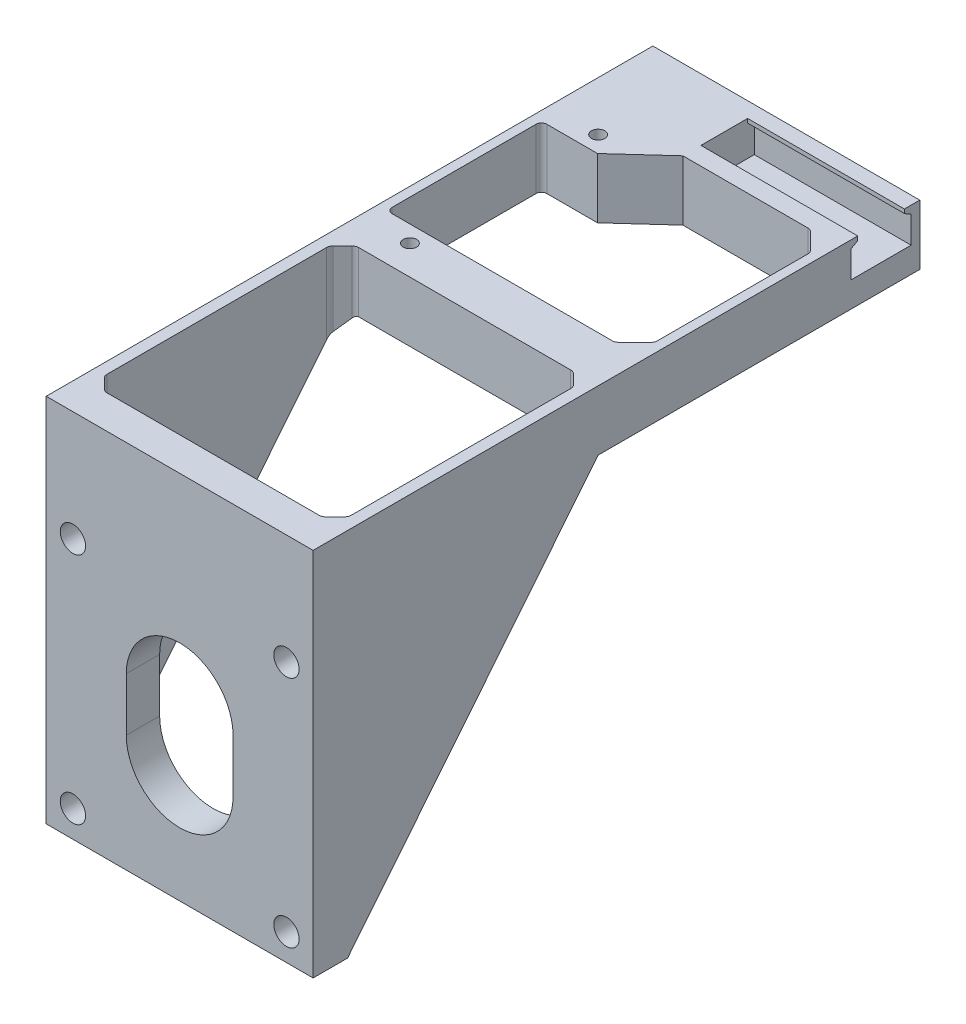
from build123d import *

# Parameters (mm, degrees)
BOSS_EXTRUDE1_START      = -1
SKETCH1_W                = 1.4
SKETCH1_H                = 89.2
BOSS_EXTRUDE1_DEPTH      = 9
SKETCH4_W                = 40
SKETCH4_H                = 12
BOSS_EXTRUDE3_DEPTH      = 9
SERVO_HOLDER_DEPTH       = 1
SERVO_HOLDER_DEPTH_BACK  = 9
SKETCH3_W                = 14
SKETCH3_H                = 7
SKETCH3_R                = 1
SKETCH37_W               = 26
SKETCH37_H               = 7
BOSS_EXTRUDE19_DEPTH     = 10
CUT_EXTRUDE10_DEPTH      = 93.388310949
CUT_EXTRUDE10_DEPTH_BACK = 93.388310949
SKETCH29_W               = 48.801454262
SKETCH29_H               = 6.177389624
BOSS_EXTRUDE17_DEPTH     = 3
SKETCH39_W               = 1.4
SKETCH39_H               = 41.3
BOSS_EXTRUDE20_DEPTH     = 9
CUT_EXTRUDE13_DEPTH      = 23.5
CHAMFER2_SIZE            = 0.6
CHAMFER2_SIZE_2          = 1.039230485
CHAMFER3_SIZE            = 3
CHAMFER4_SIZE            = 2.5
CUT_EXTRUDE16_DEPTH      = 10
FILLET11_R               = 0.8
SKETCH51_W               = 40
SKETCH51_H               = 41
CUT_EXTRUDE17_DEPTH      = 10
SKETCH50_W               = 40
SKETCH50_H               = 55.5
SKETCH50_R               = 1.9
BOSS_EXTRUDE24_DEPTH     = 5
SKETCH53_W               = 1.7
SKETCH53_H               = 37.711538462
BOSS_EXTRUDE25_DEPTH     = 9
CHAMFER6_SIZE            = 37.709072194
CHAMFER6_SIZE_2          = 46.7
CHAMFER5_SIZE            = 2
FILLET13_R               = 1


with BuildPart() as part:
    # Sketch1 → Boss-Extrude1 (new body)
    with BuildSketch(Plane(origin=(0, 0, 0), x_dir=(1, 0, 0), z_dir=(0, 1, 0)).offset(BOSS_EXTRUDE1_START)):
        with Locations((-20.7, 25.311538462)):
            Rectangle(SKETCH1_W, SKETCH1_H)
    extrude(amount=-BOSS_EXTRUDE1_DEPTH)

    # Sketch4 → Boss-Extrude3 (add)
    with BuildSketch(Plane.XZ.offset(10)):
        with Locations((-1.4, -63.911538462)):
            Rectangle(SKETCH4_W, SKETCH4_H)
    extrude(amount=-BOSS_EXTRUDE3_DEPTH)

    # Sketch3 → Servo Holder (add, two sides: drawn at the far end of the back side and taken through both)
    # profile 1 of 2: a face of its own
    with BuildSketch(Plane.XZ.offset(10).offset(-SERVO_HOLDER_DEPTH_BACK)):
        with Locations((-14.4, -55.311538462)):
            Rectangle(SKETCH3_W, SKETCH3_H)
        with Locations(Location((-14, -54.311538462, 0), (0, 0, 270))):
            Circle(SKETCH3_R, mode=Mode.SUBTRACT)
    # profile 2 of 2: a face of its own
    with BuildSketch(Plane.XZ.offset(10).offset(-SERVO_HOLDER_DEPTH_BACK)):
        with Locations((-14.4, -25.111538462)):
            Rectangle(SKETCH3_W, SKETCH3_H)
        with Locations(Location((-14, -26.111538462, 0), (0, 0, 90))):
            Circle(SKETCH3_R, mode=Mode.SUBTRACT)
    extrude(amount=SERVO_HOLDER_DEPTH + SERVO_HOLDER_DEPTH_BACK)

    # Sketch37 → Boss-Extrude19 (add)
    with BuildSketch(Plane(origin=(0, -1, 0), x_dir=(1, 0, 0), z_dir=(0, 1, 0))):
        with Locations((5.6, 25.111538462)):
            Rectangle(SKETCH37_W, SKETCH37_H)
    extrude(amount=-BOSS_EXTRUDE19_DEPTH)

    # Sketch29 → Cut-Extrude10 (cut, two sides: drawn at the far end of the back side and taken through both)
    with BuildSketch(Plane(origin=(0, 0, -69.911538462), x_dir=(-1, 0, 0), z_dir=(0, 0, -1)).offset(-CUT_EXTRUDE10_DEPTH_BACK)):
        with Locations((-3.000727131, -13.088694812)):
            Rectangle(SKETCH29_W, SKETCH29_H)
    extrude(amount=CUT_EXTRUDE10_DEPTH + CUT_EXTRUDE10_DEPTH_BACK, mode=Mode.SUBTRACT)

    # Sketch35 → Boss-Extrude17 (add)
    with BuildSketch(Plane(origin=(18.6, 0, 0), x_dir=(0, 0, -1), z_dir=(1, 0, 0))):
        Polygon((-2, -1), (21.611538462, -1), (21.611538462, -10), (-19.288461538, -10), (-19.288461538, -1), align=None)
    extrude(amount=-BOSS_EXTRUDE17_DEPTH)

    # Sketch39 → Boss-Extrude20 (add)
    with BuildSketch(Plane(origin=(0, -1, 0), x_dir=(1, 0, 0), z_dir=(0, 1, 0))):
        with Locations((17.9, 49.261538462)):
            Rectangle(SKETCH39_W, SKETCH39_H)
    extrude(amount=-BOSS_EXTRUDE20_DEPTH)

    # Sketch40 → Cut-Extrude13 (cut)
    with BuildSketch(Plane(origin=(18.6, 0, 0), x_dir=(0, 0, -1), z_dir=(1, 0, 0))):
        Polygon((64.111538462, -1), (60.611538462, -1), (60.611538462, -2.2), (59.611538462, -2.2), (59.611538462, -6.2), (64.111538462, -6.2), align=None)
        Polygon((67.611538462, -1), (64.111538462, -1), (64.111538462, -6.2), (68.611538462, -6.2), (68.611538462, -2.2), (67.611538462, -2.2), align=None)
    extrude(amount=-CUT_EXTRUDE13_DEPTH, mode=Mode.SUBTRACT)

    # Chamfer2
    # the kernel refuses this chamfer: 1.039230485, 0.6 mm, written as the material it takes off along each edge
    with BuildSketch(Plane(origin=(21.288578382, -2.2, -60.611538462), x_dir=(0, 0.9983227437537925, -0.05789386240267317), z_dir=(-1, 0, 0))) as chamfer2_piece_1_section:
        Polygon((CHAMFER2_SIZE * 0.998322743754, -CHAMFER2_SIZE * 0.0578938624027), (-CHAMFER2_SIZE_2 * 0.0578938623771, -CHAMFER2_SIZE_2 * 0.998322743313), (0, 0), align=None)
    chamfer2_piece_1 = extrude(amount=26.188578382, mode=Mode.PRIVATE)
    chamfer2_piece_1 = split(chamfer2_piece_1, bisect_by=Plane(origin=(8.194289191, -2.005782009, -59.611538462), z_dir=(0, 0, -1)), keep=Keep.TOP, mode=Mode.PRIVATE)
    add(chamfer2_piece_1, mode=Mode.SUBTRACT)
    with BuildSketch(Plane(origin=(21.288578382, -2.2, -67.611538462), x_dir=(0, 0.9983227437537925, 0.05789386240267317), z_dir=(-1, 0, 0))) as chamfer2_piece_2_section:
        Polygon((CHAMFER2_SIZE * 0.998322743754, CHAMFER2_SIZE * 0.0578938624027), (-CHAMFER2_SIZE_2 * 0.0578938623771, CHAMFER2_SIZE_2 * 0.998322743313), (0, 0), align=None)
    chamfer2_piece_2 = extrude(amount=26.188578382, mode=Mode.PRIVATE)
    chamfer2_piece_2 = split(chamfer2_piece_2, bisect_by=Plane(origin=(8.194289191, -2.005782009, -68.611538462), z_dir=(0, 0, 1)), keep=Keep.TOP, mode=Mode.PRIVATE)
    add(chamfer2_piece_2, mode=Mode.SUBTRACT)

    # Chamfer3
    chamfer3_edges = [part.edges().sort_by_distance(p)[0] for p in [
        (17.2, -5.5, -57.911538462),
        (17.2, -5.5, -28.611538462),
    ]]
    chamfer(chamfer3_edges, length=CHAMFER3_SIZE)

    # Chamfer4
    chamfer4_edges = [part.edges().sort_by_distance(p)[0] for p in [
        (-7.4, -5.5, -57.911538462),
    ]]
    chamfer(chamfer4_edges, length=CHAMFER4_SIZE)

    # Sketch43 → Cut-Extrude16 (cut)
    with BuildSketch(Plane(origin=(0, -1, 0), x_dir=(1, 0, 0), z_dir=(0, 1, 0))):
        Polygon((-4.9, 57.911538462), (-11.6, 51.811538462), (-4.9, 51.811538462), align=None)
    extrude(amount=-CUT_EXTRUDE16_DEPTH, mode=Mode.SUBTRACT)

    # Fillet11
    fillet11_edges = [part.edges().sort_by_distance(p)[0] for p in [
        (17.2, -5.5, -54.911538462),
        (17.2, -5.5, -31.611538462),
        (14.2, -5.5, -28.611538462),
        (14.2, -5.5, -57.911538462),
        (-20, -5.5, -51.811538462),
        (-20, -5.5, -28.611538462),
    ]]
    fillet(fillet11_edges, radius=FILLET11_R)

    # Sketch51 → Cut-Extrude17 (cut)
    with BuildSketch(Plane(origin=(0, -1, 0), x_dir=(1, 0, 0), z_dir=(0, 1, 0))):
        with Locations((-1.4, 1.211538462)):
            Rectangle(SKETCH51_W, SKETCH51_H)
    extrude(amount=-CUT_EXTRUDE17_DEPTH, mode=Mode.SUBTRACT)



with BuildPart() as body_2:
    # Sketch50 → Boss-Extrude24 (new body)
    with BuildSketch(Plane.XY.offset(16)):
        with Locations((-1.4, -28.75)):
            Rectangle(SKETCH50_W, SKETCH50_H)
        with Locations((-17.4, -17.5)):
            Circle(SKETCH50_R, mode=Mode.SUBTRACT)
        with Locations(Location((14.6, -17.5, 0), (0, 0, 180))):
            Circle(SKETCH50_R, mode=Mode.SUBTRACT)
        with Locations((14.6, -52.5)):
            Circle(SKETCH50_R, mode=Mode.SUBTRACT)
        with Locations(Location((-17.4, -52.5, 0), (0, 0, 180))):
            Circle(SKETCH50_R, mode=Mode.SUBTRACT)
        with BuildLine():
            Line((6.6, -31), (6.6, -39))
            ThreePointArc((6.6, -39), (-1.4, -47), (-9.4, -39))
            Line((-9.4, -39), (-9.4, -31))
            ThreePointArc((-9.4, -31), (-1.4, -23), (6.6, -31))
        make_face(mode=Mode.SUBTRACT)
    extrude(amount=BOSS_EXTRUDE24_DEPTH)


with BuildPart() as part_1:
    add(part.part)

    add(body_2.part)  # Boss-Extrude25 merges body 2
    # Sketch53 → Boss-Extrude25 (add)
    with BuildSketch(Plane(origin=(0, -1, 0), x_dir=(1, 0, 0), z_dir=(0, 1, 0))):
        with Locations((17.75, 2.855769231)):
            Rectangle(SKETCH53_W, SKETCH53_H)
        with Locations((-20.55, 2.855769231)):
            Rectangle(SKETCH53_W, SKETCH53_H)
    extrude(amount=-BOSS_EXTRUDE25_DEPTH)

    # Chamfer6
    # the kernel refuses this chamfer: 46.7, 37.709072194 mm, written as the material it adds along each edge
    with BuildSketch(Plane(origin=(-103.519116723, -10, 16), x_dir=(0, 0.03735176981942527, -0.999302179168722), z_dir=(1, 0, 0))) as chamfer6_piece_1_section:
        Polygon((CHAMFER6_SIZE * 0.99930217918, -CHAMFER6_SIZE * 0.0373517698198), (-CHAMFER6_SIZE_2 * 0.0373517698194, -CHAMFER6_SIZE_2 * 0.999302179169), (0, 0), align=None)
    chamfer6_piece_1 = extrude(amount=242.538233446, mode=Mode.PRIVATE)
    chamfer6_piece_1 = split(chamfer6_piece_1, bisect_by=Plane(origin=(-20.55, -56.5, 3.430079709), z_dir=(0, 1, 0)), keep=Keep.TOP, mode=Mode.PRIVATE)
    chamfer6_piece_1 = split(chamfer6_piece_1, bisect_by=Plane(origin=(-19.7, -25.566098081, 3.430079709), z_dir=(-1, 0, 0)), keep=Keep.TOP, mode=Mode.PRIVATE)
    chamfer6_piece_1 = split(chamfer6_piece_1, bisect_by=Plane(origin=(-21.4, -25.566098081, 3.430079709), z_dir=(1, 0, 0)), keep=Keep.TOP, mode=Mode.PRIVATE)
    add(chamfer6_piece_1)
    with BuildSketch(Plane(origin=(16.9, -10, 16), x_dir=(0, 0.03735176981942527, -0.999302179168722), z_dir=(1, 0, 0))) as chamfer6_piece_2_section:
        Polygon((CHAMFER6_SIZE * 0.99930217918, -CHAMFER6_SIZE * 0.0373517698198), (-CHAMFER6_SIZE_2 * 0.0373517698194, -CHAMFER6_SIZE_2 * 0.999302179169), (0, 0), align=None)
    chamfer6_piece_2 = extrude(amount=1.7, mode=Mode.PRIVATE)
    chamfer6_piece_2 = split(chamfer6_piece_2, bisect_by=Plane(origin=(17.75, -56.5, 3.430079709), z_dir=(0, 1, 0)), keep=Keep.TOP, mode=Mode.PRIVATE)
    add(chamfer6_piece_2)
    with BuildSketch(Plane(origin=(100.719116723, -10, 16), x_dir=(0, 0.03735176981942527, -0.999302179168722), z_dir=(-1, 0, 0))) as chamfer6_piece_3_section:
        Polygon((CHAMFER6_SIZE * 0.99930217918, CHAMFER6_SIZE * 0.0373517698198), (-CHAMFER6_SIZE_2 * 0.0373517698194, CHAMFER6_SIZE_2 * 0.999302179169), (0, 0), align=None)
    chamfer6_piece_3 = extrude(amount=242.538233446, mode=Mode.PRIVATE)
    chamfer6_piece_3 = split(chamfer6_piece_3, bisect_by=Plane(origin=(17.75, -56.5, 3.430079709), z_dir=(0, 1, 0)), keep=Keep.TOP, mode=Mode.PRIVATE)
    chamfer6_piece_3 = split(chamfer6_piece_3, bisect_by=Plane(origin=(18.6, -25.566098081, 3.430079709), z_dir=(-1, 0, 0)), keep=Keep.TOP, mode=Mode.PRIVATE)
    chamfer6_piece_3 = split(chamfer6_piece_3, bisect_by=Plane(origin=(16.9, -25.566098081, 3.430079709), z_dir=(1, 0, 0)), keep=Keep.TOP, mode=Mode.PRIVATE)
    add(chamfer6_piece_3)
    with BuildSketch(Plane(origin=(-19.7, -10, 16), x_dir=(0, 0.03735176981942527, -0.999302179168722), z_dir=(-1, 0, 0))) as chamfer6_piece_4_section:
        Polygon((CHAMFER6_SIZE * 0.99930217918, CHAMFER6_SIZE * 0.0373517698198), (-CHAMFER6_SIZE_2 * 0.0373517698194, CHAMFER6_SIZE_2 * 0.999302179169), (0, 0), align=None)
    chamfer6_piece_4 = extrude(amount=1.7, mode=Mode.PRIVATE)
    chamfer6_piece_4 = split(chamfer6_piece_4, bisect_by=Plane(origin=(-20.55, -56.5, 3.430079709), z_dir=(0, 1, 0)), keep=Keep.TOP, mode=Mode.PRIVATE)
    add(chamfer6_piece_4)

    # Chamfer5
    # the kernel refuses this chamfer: 2 mm, written as the material it adds along each edge
    with BuildSketch(Plane(origin=(16.9, -56.5, 16), x_dir=(-0.9996219169115486, 9.398995055906874e-15, 0.027495876601428135), z_dir=(0, 1, 0))) as chamfer5_piece_1_section:
        Polygon((CHAMFER5_SIZE * 0.999621916911, -CHAMFER5_SIZE * 0.0274958766107), (-CHAMFER5_SIZE * 0.0274958766014, -CHAMFER5_SIZE * 0.999621916912), (0, 0), align=None)
    chamfer5_piece_1 = extrude(amount=55.5, mode=Mode.PRIVATE)
    chamfer5_piece_1 = chamfer5_piece_1 - Plane(origin=(14.6, -52.5, 15.332756943), x_dir=(1, 0, 0), z_dir=(0, 0, -1)) * Cylinder(1.9, 119, mode=Mode.PRIVATE)
    chamfer5_piece_1 = chamfer5_piece_1 - Plane(origin=(14.6, -17.5, 15.332756943), x_dir=(-1, 0, 0), z_dir=(0, 0, -1)) * Cylinder(1.9, 119, mode=Mode.PRIVATE)
    chamfer5_piece_1 = split(chamfer5_piece_1, bisect_by=Plane(origin=(16.262747453, -39.032256487, 1.733742705), z_dir=(0, 0.6282346774929722, 0.7780239006581362)), keep=Keep.TOP, mode=Mode.PRIVATE)
    add(chamfer5_piece_1)
    with BuildSketch(Plane(origin=(-19.7, -1, 16), x_dir=(0.9996219169112968, 9.144800521055879e-15, 0.027495876610585647), z_dir=(0, -1, 0))) as chamfer5_piece_2_section:
        Polygon((CHAMFER5_SIZE * 0.999621916911, -CHAMFER5_SIZE * 0.0274958766106), (-CHAMFER5_SIZE * 0.0274958766106, -CHAMFER5_SIZE * 0.999621916911), (0, 0), align=None)
    chamfer5_piece_2 = extrude(amount=55.5, mode=Mode.PRIVATE)
    chamfer5_piece_2 = split(chamfer5_piece_2, bisect_by=Plane(origin=(-19.062747543, -39.032254695, 1.733741258), z_dir=(0, 0.6282346774929722, 0.7780239006581362)), keep=Keep.TOP, mode=Mode.PRIVATE)
    chamfer5_piece_2 = chamfer5_piece_2 - Plane(origin=(-17.4, -52.5, 15.332756844), x_dir=(-1, 0, 0), z_dir=(0, 0, -1)) * Cylinder(1.9, 119, mode=Mode.PRIVATE)
    chamfer5_piece_2 = chamfer5_piece_2 - Plane(origin=(-17.4, -17.5, 15.332756844), x_dir=(1, 0, 0), z_dir=(0, 0, -1)) * Cylinder(1.9, 119, mode=Mode.PRIVATE)
    add(chamfer5_piece_2)
    with BuildSketch(Plane(origin=(16.9, -1, -21.711538462), x_dir=(-0.9996219169112968, 0, -0.027495876610585623), z_dir=(0, -1, 0))) as chamfer5_piece_3_section:
        Polygon((CHAMFER5_SIZE * 0.999621916911, -CHAMFER5_SIZE * 0.0274958766106), (-CHAMFER5_SIZE * 0.0274958766106, -CHAMFER5_SIZE * 0.999621916911), (0, 0), align=None)
    chamfer5_piece_3 = extrude(amount=9, mode=Mode.PRIVATE)
    chamfer5_piece_3 = split(chamfer5_piece_3, bisect_by=Plane(origin=(16.240555147, -7.596785669, -23.649607156), z_dir=(0, 0.6282346774929722, 0.7780239006581362)), keep=Keep.TOP, mode=Mode.PRIVATE)
    add(chamfer5_piece_3)
    with BuildSketch(Plane(origin=(16.9, -1, -21.711538462), x_dir=(-0.9996219169112968, 0, -0.027495876610585623), z_dir=(0, -1, 0))) as chamfer5_piece_4_section:
        Polygon((CHAMFER5_SIZE * 0.999621916911, -CHAMFER5_SIZE * 0.0274958766106), (-CHAMFER5_SIZE * 0.0274958766106, -CHAMFER5_SIZE * 0.999621916911), (0, 0), align=None)
    chamfer5_piece_4 = extrude(amount=14.143365976, mode=Mode.PRIVATE)
    chamfer5_piece_4 = split(chamfer5_piece_4, bisect_by=Plane(origin=(16.445051709, -10, -20.667722812), z_dir=(0, -1, 0)), keep=Keep.TOP, mode=Mode.PRIVATE)
    chamfer5_piece_4 = split(chamfer5_piece_4, bisect_by=Plane(origin=(16.445051709, -10.899314724, -20.982898236), z_dir=(0, 0.6282346774929722, 0.7780239006581362)), keep=Keep.TOP, mode=Mode.PRIVATE)
    add(chamfer5_piece_4)
    with BuildSketch(Plane(origin=(16.9, -1, -21.711538462), x_dir=(-0.9996219169112968, 0, -0.027495876610585623), z_dir=(0, -1, 0))) as chamfer5_piece_5_section:
        Polygon((CHAMFER5_SIZE * 0.999621916911, -CHAMFER5_SIZE * 0.0274958766106), (-CHAMFER5_SIZE * 0.0274958766106, -CHAMFER5_SIZE * 0.999621916911), (0, 0), align=None)
    chamfer5_piece_5 = extrude(amount=9, mode=Mode.PRIVATE)
    chamfer5_piece_5 = split(chamfer5_piece_5, bisect_by=Plane(origin=(15.504496117, -9.96219574, -21.739598181), z_dir=(0, -0.6282346774929722, -0.7780239006581362)), keep=Keep.TOP, mode=Mode.PRIVATE)
    add(chamfer5_piece_5)
    with BuildSketch(Plane(origin=(-19.7, -1, -21.711538462), x_dir=(0.9996219169112968, 0, -0.0274958766105856), z_dir=(0, -1, 0))) as chamfer5_piece_6_section:
        Polygon((CHAMFER5_SIZE * 0.999621916911, CHAMFER5_SIZE * 0.0274958766106), (-CHAMFER5_SIZE * 0.0274958766106, CHAMFER5_SIZE * 0.999621916911), (0, 0), align=None)
    chamfer5_piece_6 = extrude(amount=9, mode=Mode.PRIVATE)
    chamfer5_piece_6 = split(chamfer5_piece_6, bisect_by=Plane(origin=(-19.040555147, -7.596785669, -23.649607156), z_dir=(0, 0.6282346774929722, 0.7780239006581362)), keep=Keep.TOP, mode=Mode.PRIVATE)
    add(chamfer5_piece_6)
    with BuildSketch(Plane(origin=(-19.7, -1, -21.711538462), x_dir=(0.9996219169112968, 0, -0.0274958766105856), z_dir=(0, -1, 0))) as chamfer5_piece_7_section:
        Polygon((CHAMFER5_SIZE * 0.999621916911, CHAMFER5_SIZE * 0.0274958766106), (-CHAMFER5_SIZE * 0.0274958766106, CHAMFER5_SIZE * 0.999621916911), (0, 0), align=None)
    chamfer5_piece_7 = extrude(amount=14.143365976, mode=Mode.PRIVATE)
    chamfer5_piece_7 = split(chamfer5_piece_7, bisect_by=Plane(origin=(-19.245051709, -10.899314724, -20.982898236), z_dir=(0, 0.6282346774929722, 0.7780239006581362)), keep=Keep.TOP, mode=Mode.PRIVATE)
    chamfer5_piece_7 = split(chamfer5_piece_7, bisect_by=Plane(origin=(-19.245051709, -10, -20.667722812), z_dir=(0, -1, 0)), keep=Keep.TOP, mode=Mode.PRIVATE)
    add(chamfer5_piece_7)
    with BuildSketch(Plane(origin=(-19.7, -1, -21.711538462), x_dir=(0.9996219169112968, 0, -0.0274958766105856), z_dir=(0, -1, 0))) as chamfer5_piece_8_section:
        Polygon((CHAMFER5_SIZE * 0.999621916911, CHAMFER5_SIZE * 0.0274958766106), (-CHAMFER5_SIZE * 0.0274958766106, CHAMFER5_SIZE * 0.999621916911), (0, 0), align=None)
    chamfer5_piece_8 = extrude(amount=9, mode=Mode.PRIVATE)
    chamfer5_piece_8 = split(chamfer5_piece_8, bisect_by=Plane(origin=(-18.304496117, -9.96219574, -21.739598181), z_dir=(0, -0.6282346774929722, -0.7780239006581362)), keep=Keep.TOP, mode=Mode.PRIVATE)
    add(chamfer5_piece_8)

    # Fillet13
    # the kernel refuses this fillet: 1 mm, written as the material it adds along each edge
    with BuildSketch(Plane(origin=(16.9, -55.25867636, 14), x_dir=(0, 0, -1), z_dir=(0, 1, 0))) as fillet13_piece_1_section:
        with BuildLine():
            CenterArc((FILLET13_R * 0.414213562376, FILLET13_R), FILLET13_R, 225, 45)
            Line((-FILLET13_R * 0.292893218814, FILLET13_R * 0.292893218817), (0, 0))
            Line((0, 0), (FILLET13_R * 0.414213562376, 0))
        make_face()
    fillet13_piece_1 = extrude(amount=54.25867636, mode=Mode.PRIVATE)
    fillet13_piece_1 = split(fillet13_piece_1, bisect_by=Plane(origin=(16.837951776, -38.093007008, 0.97532244), z_dir=(0, 0.6282346774930556, 0.7780239006580688)), keep=Keep.TOP, mode=Mode.PRIVATE)
    add(fillet13_piece_1)
    with BuildSketch(Plane(origin=(14.9, -16.659367602, 16), x_dir=(0.7071067811898626, 0, -0.7071067811832326), z_dir=(0, 1, 0))) as fillet13_piece_2_section:
        with BuildLine():
            CenterArc((FILLET13_R * 0.41421356237, FILLET13_R), FILLET13_R, 225, 45)
            Line((-FILLET13_R * 0.292893218813, FILLET13_R * 0.29289321881), (0, 0))
            Line((0, 0), (FILLET13_R * 0.41421356237, 0))
        make_face()
    fillet13_piece_2 = extrude(amount=15.659367602, mode=Mode.PRIVATE)
    fillet13_piece_2 = fillet13_piece_2 - Plane(origin=(14.6, -17.5, 15.93807593), x_dir=(-1, 0, 0), z_dir=(0, 0, -1)) * Cylinder(1.9, 33, mode=Mode.PRIVATE)
    add(fillet13_piece_2)
    with BuildSketch(Plane(origin=(14.9, -56.5, 16), x_dir=(0.7071067811898647, 0, -0.7071067811832304), z_dir=(0, 1, 0))) as fillet13_piece_3_section:
        with BuildLine():
            CenterArc((FILLET13_R * 0.41421356237, FILLET13_R), FILLET13_R, 225, 45)
            Line((-FILLET13_R * 0.292893218813, FILLET13_R * 0.29289321881), (0, 0))
            Line((0, 0), (FILLET13_R * 0.41421356237, 0))
        make_face()
    fillet13_piece_3 = extrude(amount=3.159367602, mode=Mode.PRIVATE)
    fillet13_piece_3 = split(fillet13_piece_3, bisect_by=Plane(origin=(14.874971932, -55.902415279, 15.355970453), z_dir=(0, 0.6282346774930556, 0.7780239006580688)), keep=Keep.TOP, mode=Mode.PRIVATE)
    fillet13_piece_3 = fillet13_piece_3 - Plane(origin=(14.6, -52.5, 15.938106757), x_dir=(1, 0, 0), z_dir=(0, 0, -1)) * Cylinder(1.9, 8, mode=Mode.PRIVATE)
    add(fillet13_piece_3)
    with BuildSketch(Plane(origin=(-17.7, -53.340632398, 16), x_dir=(-0.7071067811862645, 0, -0.7071067811868306), z_dir=(0, -1, 0))) as fillet13_piece_4_section:
        with BuildLine():
            CenterArc((FILLET13_R * 0.414213562373, FILLET13_R), FILLET13_R, 225, 45)
            Line((-FILLET13_R * 0.292893218814, FILLET13_R * 0.292893218814), (0, 0))
            Line((0, 0), (FILLET13_R * 0.414213562373, 0))
        make_face()
    fillet13_piece_4 = extrude(amount=3.159367602, mode=Mode.PRIVATE)
    fillet13_piece_4 = fillet13_piece_4 - Plane(origin=(-17.4, -52.5, 15.938106777), x_dir=(-1, 0, 0), z_dir=(0, 0, -1)) * Cylinder(1.9, 8, mode=Mode.PRIVATE)
    fillet13_piece_4 = split(fillet13_piece_4, bisect_by=Plane(origin=(-17.674971948, -55.902415691, 15.355970786), z_dir=(0, 0.6282346774930556, 0.7780239006580688)), keep=Keep.TOP, mode=Mode.PRIVATE)
    add(fillet13_piece_4)
    with BuildSketch(Plane(origin=(-17.7, -1, 16), x_dir=(-0.7071067811862667, 0, -0.7071067811868285), z_dir=(0, -1, 0))) as fillet13_piece_5_section:
        with BuildLine():
            CenterArc((FILLET13_R * 0.414213562373, FILLET13_R), FILLET13_R, 225, 45)
            Line((-FILLET13_R * 0.292893218814, FILLET13_R * 0.292893218814), (0, 0))
            Line((0, 0), (FILLET13_R * 0.414213562373, 0))
        make_face()
    fillet13_piece_5 = extrude(amount=15.659367602, mode=Mode.PRIVATE)
    fillet13_piece_5 = fillet13_piece_5 - Plane(origin=(-17.4, -17.5, 15.938075915), x_dir=(1, 0, 0), z_dir=(0, 0, -1)) * Cylinder(1.9, 33, mode=Mode.PRIVATE)
    add(fillet13_piece_5)
    with BuildSketch(Plane(origin=(-19.7, -1, 14), x_dir=(0.7071067811862645, 0, 0.7071067811868306), z_dir=(0, -1, 0))) as fillet13_piece_6_section:
        with BuildLine():
            CenterArc((FILLET13_R * 0.414213562373, -FILLET13_R), FILLET13_R, 90, 45)
            Line((-FILLET13_R * 0.292893218813, -FILLET13_R * 0.292893218813), (0, 0))
            Line((0, 0), (FILLET13_R * 0.414213562373, 0))
        make_face()
    fillet13_piece_6 = extrude(amount=54.25867636, mode=Mode.PRIVATE)
    fillet13_piece_6 = split(fillet13_piece_6, bisect_by=Plane(origin=(-19.637951776, -38.093007007, 0.975322439), z_dir=(0, 0.6282346774930556, 0.7780239006580688)), keep=Keep.TOP, mode=Mode.PRIVATE)
    add(fillet13_piece_6)
    with BuildSketch(Plane(origin=(-17.7, -18.340632398, 16), x_dir=(-0.7071067811862645, 0, -0.7071067811868306), z_dir=(0, -1, 0))) as fillet13_piece_7_section:
        with BuildLine():
            CenterArc((FILLET13_R * 0.414213562373, FILLET13_R), FILLET13_R, 225, 45)
            Line((-FILLET13_R * 0.292893218814, FILLET13_R * 0.292893218814), (0, 0))
            Line((0, 0), (FILLET13_R * 0.414213562373, 0))
        make_face()
    fillet13_piece_7 = extrude(amount=33.318735204, mode=Mode.PRIVATE)
    fillet13_piece_7 = fillet13_piece_7 - Plane(origin=(-17.4, -52.5, 15.938083204), x_dir=(-1, 0, 0), z_dir=(0, 0, -1)) * Cylinder(1.9, 69, mode=Mode.PRIVATE)
    fillet13_piece_7 = fillet13_piece_7 - Plane(origin=(-17.4, -17.5, 15.938083204), x_dir=(1, 0, 0), z_dir=(0, 0, -1)) * Cylinder(1.9, 69, mode=Mode.PRIVATE)
    add(fillet13_piece_7)
    with BuildSketch(Plane(origin=(14.9, -51.659367602, 16), x_dir=(0.7071067811898626, 0, -0.7071067811832326), z_dir=(0, 1, 0))) as fillet13_piece_8_section:
        with BuildLine():
            CenterArc((FILLET13_R * 0.41421356237, FILLET13_R), FILLET13_R, 225, 45)
            Line((-FILLET13_R * 0.292893218813, FILLET13_R * 0.29289321881), (0, 0))
            Line((0, 0), (FILLET13_R * 0.41421356237, 0))
        make_face()
    fillet13_piece_8 = extrude(amount=33.318735204, mode=Mode.PRIVATE)
    fillet13_piece_8 = fillet13_piece_8 - Plane(origin=(14.6, -17.5, 15.938083204), x_dir=(-1, 0, 0), z_dir=(0, 0, -1)) * Cylinder(1.9, 69, mode=Mode.PRIVATE)
    fillet13_piece_8 = fillet13_piece_8 - Plane(origin=(14.6, -52.5, 15.938083204), x_dir=(1, 0, 0), z_dir=(0, 0, -1)) * Cylinder(1.9, 69, mode=Mode.PRIVATE)
    add(fillet13_piece_8)
    with BuildSketch(Plane(origin=(-19.7, -1, -19.711538462), x_dir=(0.7071067811862645, 0, -0.7071067811868306), z_dir=(0, -1, 0))) as fillet13_piece_9_section:
        with BuildLine():
            CenterArc((FILLET13_R * 0.414213562373, FILLET13_R), FILLET13_R, 225, 45)
            Line((-FILLET13_R * 0.292893218813, FILLET13_R * 0.292893218813), (0, 0))
            Line((0, 0), (FILLET13_R * 0.414213562373, 0))
        make_face()
    fillet13_piece_9 = extrude(amount=12.509337155, mode=Mode.PRIVATE)
    fillet13_piece_9 = split(fillet13_piece_9, bisect_by=Plane(origin=(-19.639290541, -9.02566381, -22.495824094), z_dir=(0, 0.6282346774930556, 0.7780239006580688)), keep=Keep.TOP, mode=Mode.PRIVATE)
    add(fillet13_piece_9)
    with BuildSketch(Plane(origin=(-17.7, -10, -21.711538462), x_dir=(-0.7071067811862645, 0, 0.7071067811868306), z_dir=(0, 1, 0))) as fillet13_piece_10_section:
        with BuildLine():
            CenterArc((FILLET13_R * 0.414213562373, FILLET13_R), FILLET13_R, 225, 45)
            Line((-FILLET13_R * 0.292893218814, FILLET13_R * 0.292893218814), (0, 0))
            Line((0, 0), (FILLET13_R * 0.414213562373, 0))
        make_face()
    fillet13_piece_10 = extrude(amount=9, mode=Mode.PRIVATE)
    fillet13_piece_10 = split(fillet13_piece_10, bisect_by=Plane(origin=(-17.501015195, -9.987109411, -21.71948102), z_dir=(0, -0.6282346774930556, -0.7780239006580688)), keep=Keep.TOP, mode=Mode.PRIVATE)
    add(fillet13_piece_10)
    with BuildSketch(Plane(origin=(-17.7, -11.035533906, -21.711538462), x_dir=(-0.7071067811862645, 0, 0.7071067811868306), z_dir=(0, 1, 0))) as fillet13_piece_11_section:
        with BuildLine():
            CenterArc((FILLET13_R * 0.414213562373, FILLET13_R), FILLET13_R, 225, 45)
            Line((-FILLET13_R * 0.292893218813, FILLET13_R * 0.292893218814), (0, 0))
            Line((0, 0), (FILLET13_R * 0.414213562373, 0))
        make_face()
    fillet13_piece_11 = extrude(amount=10.035533906, mode=Mode.PRIVATE)
    fillet13_piece_11 = split(fillet13_piece_11, bisect_by=Plane(origin=(-17.830954669, -10, -21.563659576), z_dir=(0, -1, 0)), keep=Keep.TOP, mode=Mode.PRIVATE)
    fillet13_piece_11 = split(fillet13_piece_11, bisect_by=Plane(origin=(-17.830954669, -10.125579091, -21.607670245), z_dir=(0, 0.6282346774930556, 0.7780239006580688)), keep=Keep.TOP, mode=Mode.PRIVATE)
    add(fillet13_piece_11)
    with BuildSketch(Plane(origin=(-17.7, -10, -21.711538462), x_dir=(-0.7071067811862645, 0, 0.7071067811868306), z_dir=(0, 1, 0))) as fillet13_piece_12_section:
        with BuildLine():
            CenterArc((FILLET13_R * 0.414213562373, FILLET13_R), FILLET13_R, 225, 45)
            Line((-FILLET13_R * 0.292893218814, FILLET13_R * 0.292893218814), (0, 0))
            Line((0, 0), (FILLET13_R * 0.414213562373, 0))
        make_face()
    fillet13_piece_12 = extrude(amount=9, mode=Mode.PRIVATE)
    fillet13_piece_12 = split(fillet13_piece_12, bisect_by=Plane(origin=(-17.674465043, -7.304014486, -23.886012503), z_dir=(0, 0.6282346774930556, 0.7780239006580688)), keep=Keep.TOP, mode=Mode.PRIVATE)
    add(fillet13_piece_12)
    with BuildSketch(Plane(origin=(16.9, -13.509337155, -19.711538462), x_dir=(-0.7071067811862645, 0, -0.7071067811868306), z_dir=(0, 1, 0))) as fillet13_piece_13_section:
        with BuildLine():
            CenterArc((FILLET13_R * 0.414213562373, FILLET13_R), FILLET13_R, 225, 45)
            Line((-FILLET13_R * 0.292893218813, FILLET13_R * 0.292893218813), (0, 0))
            Line((0, 0), (FILLET13_R * 0.414213562373, 0))
        make_face()
    fillet13_piece_13 = extrude(amount=12.509337155, mode=Mode.PRIVATE)
    fillet13_piece_13 = split(fillet13_piece_13, bisect_by=Plane(origin=(16.839290541, -9.02566381, -22.495824094), z_dir=(0, 0.6282346774930556, 0.7780239006580688)), keep=Keep.TOP, mode=Mode.PRIVATE)
    add(fillet13_piece_13)
    with BuildSketch(Plane(origin=(14.9, -1, -21.711538462), x_dir=(-1, 0, 0), z_dir=(0, -1, 0))) as fillet13_piece_14_section:
        with BuildLine():
            CenterArc((FILLET13_R * 0.414213562374, -FILLET13_R), FILLET13_R, 90, 45)
            Line((-FILLET13_R * 0.292893218813, -FILLET13_R * 0.292893218814), (0, 0))
            Line((0, 0), (FILLET13_R * 0.414213562373, 0))
        make_face()
    fillet13_piece_14 = extrude(amount=9, mode=Mode.PRIVATE)
    fillet13_piece_14 = split(fillet13_piece_14, bisect_by=Plane(origin=(14.874465043, -7.304014485, -23.886012503), z_dir=(0, 0.6282346774930556, 0.7780239006580688)), keep=Keep.TOP, mode=Mode.PRIVATE)
    add(fillet13_piece_14)
    with BuildSketch(Plane(origin=(14.9, -1, -21.711538462), x_dir=(-1, 0, 0), z_dir=(0, -1, 0))) as fillet13_piece_15_section:
        with BuildLine():
            CenterArc((FILLET13_R * 0.414213562374, -FILLET13_R), FILLET13_R, 90, 45)
            Line((-FILLET13_R * 0.292893218813, -FILLET13_R * 0.292893218814), (0, 0))
            Line((0, 0), (FILLET13_R * 0.414213562373, 0))
        make_face()
    fillet13_piece_15 = extrude(amount=10.035533906, mode=Mode.PRIVATE)
    fillet13_piece_15 = split(fillet13_piece_15, bisect_by=Plane(origin=(15.030954665, -10, -21.563659577), z_dir=(0, -1, 0)), keep=Keep.TOP, mode=Mode.PRIVATE)
    fillet13_piece_15 = split(fillet13_piece_15, bisect_by=Plane(origin=(15.030954665, -10.12557909, -21.607670246), z_dir=(0, 0.6282346774930556, 0.7780239006580688)), keep=Keep.TOP, mode=Mode.PRIVATE)
    add(fillet13_piece_15)
    with BuildSketch(Plane(origin=(14.9, -1, -21.711538462), x_dir=(-1, 0, 0), z_dir=(0, -1, 0))) as fillet13_piece_16_section:
        with BuildLine():
            CenterArc((FILLET13_R * 0.414213562374, -FILLET13_R), FILLET13_R, 90, 45)
            Line((-FILLET13_R * 0.292893218813, -FILLET13_R * 0.292893218814), (0, 0))
            Line((0, 0), (FILLET13_R * 0.414213562373, 0))
        make_face()
    fillet13_piece_16 = extrude(amount=9, mode=Mode.PRIVATE)
    fillet13_piece_16 = split(fillet13_piece_16, bisect_by=Plane(origin=(14.701015196, -9.987109411, -21.71948102), z_dir=(0, -0.6282346774930556, -0.7780239006580688)), keep=Keep.TOP, mode=Mode.PRIVATE)
    add(fillet13_piece_16)


solid = part_1.part
